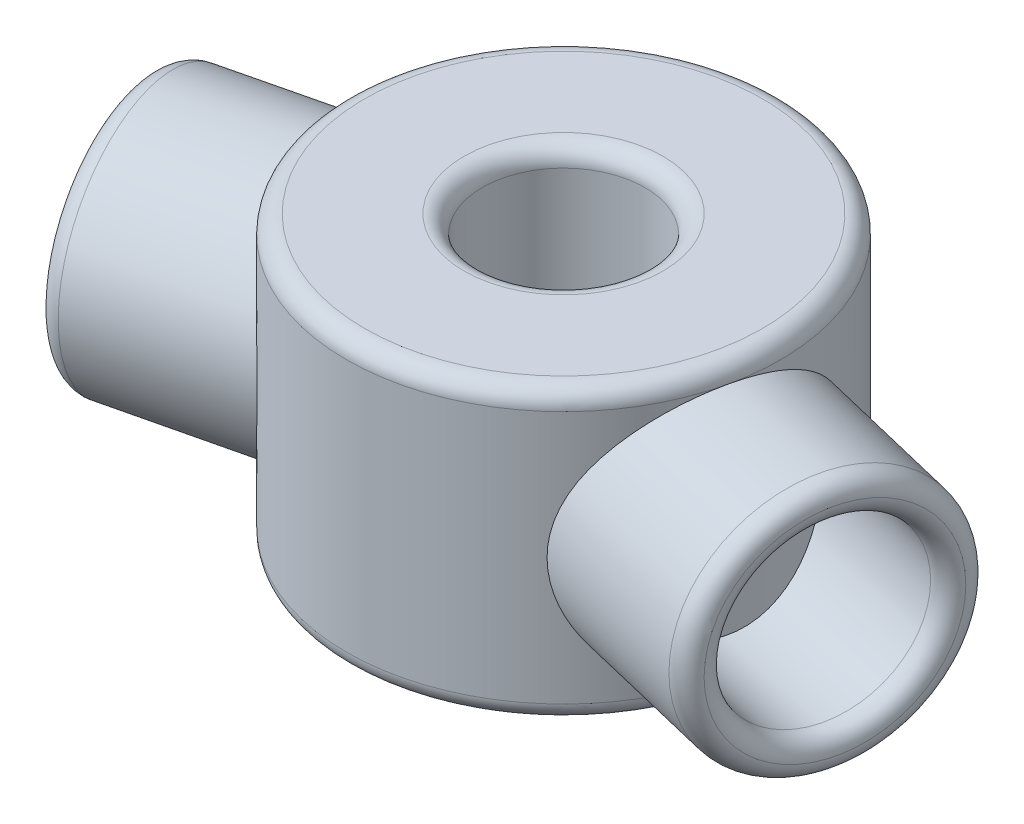
from build123d import *

# Parameters (mm, degrees)
SKETCH1_R           = 38.1
SKETCH1_R_2         = 14.2875
BOSS_EXTRUDE1_DEPTH = 25.4
BOSS_EXTRUDE2_START = -25.4
SKETCH3_R           = 22.225
SKETCH3_R_2         = 15.875
BOSS_EXTRUDE2_DEPTH = 33.655
FILLET1_R           = 3.175


with BuildPart() as part:
    # Sketch1 → Boss-Extrude1 (new, symmetric)
    with BuildSketch(Plane(origin=(0, 0, 0), x_dir=(1, 0, 0), z_dir=(0, 1, 0))):
        with Locations(Location((0, 0, 0), (0, 0, 270))):
            Circle(SKETCH1_R)
        with Locations(Location((0, 0, 0), (0, 0, 270))):
            Circle(SKETCH1_R_2, mode=Mode.SUBTRACT)
    extrude(amount=BOSS_EXTRUDE1_DEPTH, both=True)

    # Sketch3 → Boss-Extrude2 (add)
    with BuildSketch(Plane(origin=(37.182385695, 0, 8.311449576), x_dir=(-0.2334453638559059, 0, 0.9723699203976764), z_dir=(-0.9723699203976764, 0, -0.2334453638559059)).offset(BOSS_EXTRUDE2_START)):
        with Locations(Location((0, 0, 0), (0, 0, 180))):
            Circle(SKETCH3_R)
        with Locations(Location((0, 0, 0), (0, 0, 180))):
            Circle(SKETCH3_R_2, mode=Mode.SUBTRACT)
    boss_extrude2 = extrude(amount=BOSS_EXTRUDE2_DEPTH)

    # Mirror1: Boss-Extrude2 across plane
    add(boss_extrude2.mirror(Plane(origin=(0, 0, 0), x_dir=(0, 0, 1), z_dir=(1, 0, 0))))

    # Fillet1
    fillet1_edges = [part.edges().sort_by_distance(p)[0] for p in [
        (0, 25.4, -14.2875),
        (56.692258461, 0, 35.851883299),
        (58.174636521, 0, 29.677334305),
        (-56.692258461, 0, 35.851883299),
        (0, -25.4, -14.2875),
        (0, -25.4, -38.1),
        (0, 25.4, -38.1),
    ]]
    fillet(fillet1_edges, radius=FILLET1_R - 0.0001)  # a hair under: the kernel refuses the full size


solid = part.part
